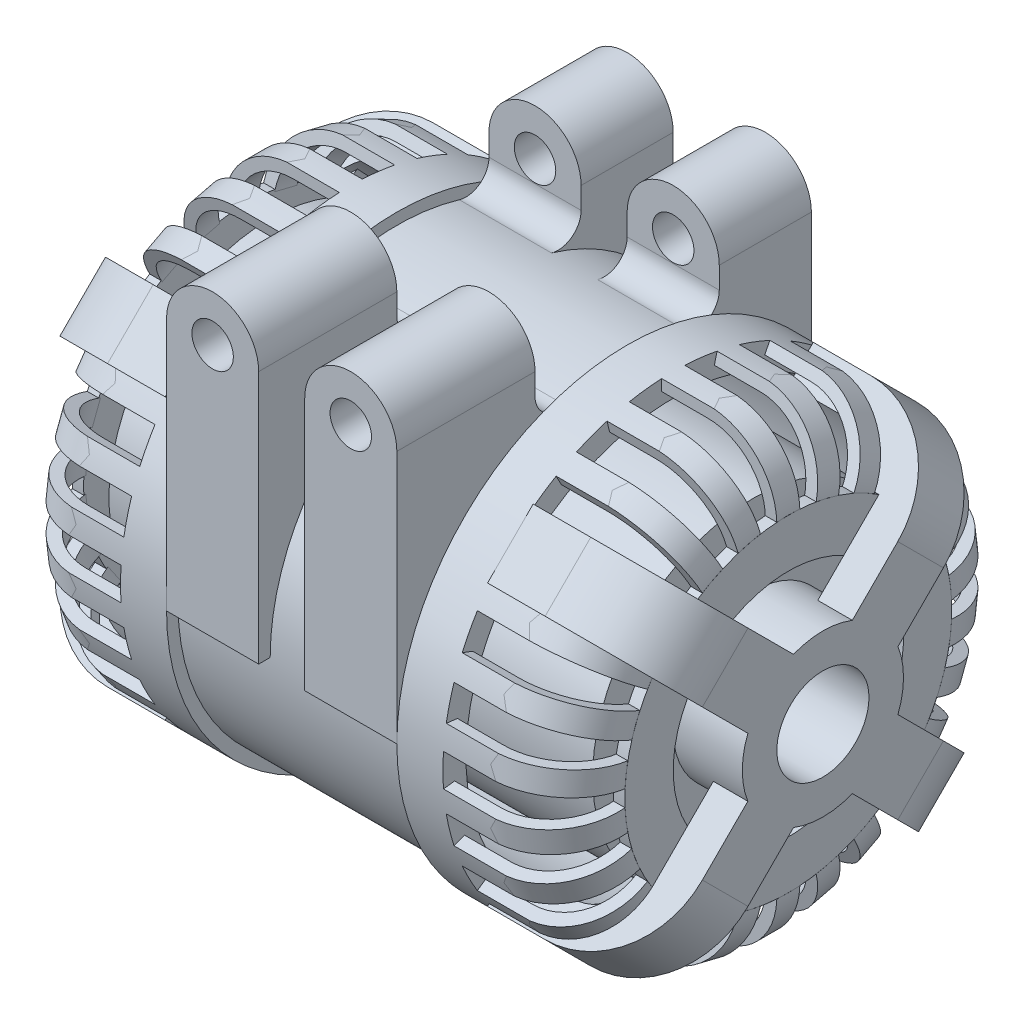
from build123d import *

# Parameters (mm, degrees)
SKETCH1_R                 = 50
SKETCH1_R_2               = 47.5
BOSS_EXTRUDE1_DEPTH       = 10
BOSS_EXTRUDE2_DEPTH       = 2.5
CIRPATTERN1_COUNT         = 26
SKETCH6_R                 = 35.5
SKETCH6_R_2               = 25
BOSS_EXTRUDE3_DEPTH       = 2.5
SKETCH7_OUTSIDE_W         = 131.138
SKETCH7_OUTSIDE_H         = 131.138
SKETCH7_OUTSIDE_R         = 50
CUT_EXTRUDE4_DEPTH        = 76.0000001
BOSS_EXTRUDE4_DEPTH       = 7
CIRPATTERN2_COUNT         = 4
SKETCH9_R                 = 17.5
BOSS_EXTRUDE5_DEPTH       = 15
SKETCH10_R                = 35
BOSS_EXTRUDE6_DEPTH       = 105
BOSS_EXTRUDE7_DEPTH       = 35
BOSS_EXTRUDE7_DEPTH_BACK  = 35
SKETCH11_R                = 47.5
SKETCH11_R_2              = 45
BOSS_EXTRUDE8_REACH       = 163.961
BOSS_EXTRUDE8_END_RADIUS  = 47.5
SKETCH13_W                = 20
SKETCH13_H                = 20
CUT_EXTRUDE5_DEPTH        = 132.267855966
CUT_EXTRUDE5_DEPTH_BACK   = 132.267855966
SKETCH14_R                = 4.5
FILLET1_R                 = 5
BOSS_EXTRUDE10_REACH      = 159.262
BOSS_EXTRUDE10_END_RADIUS = 47.5
SKETCH15_W                = 20
SKETCH15_H                = 41.306779105
BOSS_EXTRUDE11_START      = -10
SKETCH15_3_R              = 4.5
BOSS_EXTRUDE11_DEPTH      = 10
SKETCH18_R                = 10
CUT_EXTRUDE6_DEPTH        = 20


with BuildPart() as part:
    # Sketch1 → Boss-Extrude1 (new body)
    with BuildSketch(Plane(origin=(0, 0, 0), x_dir=(0, 0, -1), z_dir=(1, 0, 0))):
        Circle(SKETCH1_R)
        Circle(SKETCH1_R_2, mode=Mode.SUBTRACT)
    extrude(amount=-BOSS_EXTRUDE1_DEPTH)

    # Sketch5 → Boss-Extrude2 (add, symmetric)
    with BuildSketch(Plane.XY):
        with BuildLine():
            Line((0, 50), (10, 50))
            ThreePointArc((10, 50), (20.606601718, 45.606601718), (25, 35))
            Line((25, 35), (22.5, 35))
            ThreePointArc((22.5, 35), (18.838834765, 43.838834765), (10, 47.5))
            Line((10, 47.5), (0, 47.5))
            Line((0, 47.5), (0, 50))
        make_face()
    boss_extrude2 = extrude(amount=BOSS_EXTRUDE2_DEPTH, both=True)

    # CirPattern1: Boss-Extrude2 ×26 about axis
    cirpattern1_axis = Axis((0, 0, 0), (1, 0, 0))
    for i in range(1, CIRPATTERN1_COUNT):
        add(boss_extrude2.rotate(cirpattern1_axis, i * 360 / CIRPATTERN1_COUNT))

    # Sketch6 → Boss-Extrude3 (add)
    with BuildSketch(Plane.ZY.offset(-25)):
        with Locations(Location((0, 0, 0), (0, 0, 182.884820327))):
            Circle(SKETCH6_R)
        Circle(SKETCH6_R_2, mode=Mode.SUBTRACT)
    extrude(amount=BOSS_EXTRUDE3_DEPTH)

    # Sketch7 outside → Cut-Extrude4 (cut, through all)
    with BuildSketch(Plane(origin=(0, 0, 0), x_dir=(0, 0, -1), z_dir=(1, 0, 0))):
        Rectangle(SKETCH7_OUTSIDE_W, SKETCH7_OUTSIDE_H)
        Circle(SKETCH7_OUTSIDE_R, mode=Mode.SUBTRACT)
    extrude(amount=CUT_EXTRUDE4_DEPTH, mode=Mode.SUBTRACT)

    # Sketch8 → Boss-Extrude4 (add, symmetric)
    with BuildSketch(Plane(origin=(0, 0, 0), x_dir=(1, 0, 0), z_dir=(0, -0.7071067811865488, 0.7071067811865464))):
        with BuildLine():
            Line((0, 42.5), (0, 50))
            Line((0, 50), (12.5, 50))
            ThreePointArc((12.5, 50), (26.642135624, 44.142135624), (32.5, 30))
            Line((32.5, 30), (32.5, -10))
            Line((32.5, -10), (25, -10))
            Line((25, -10), (25, 30))
            ThreePointArc((25, 30), (21.338834765, 38.838834765), (12.5, 42.5))
            Line((12.5, 42.5), (0, 42.5))
        make_face()
    boss_extrude4 = extrude(amount=BOSS_EXTRUDE4_DEPTH, both=True)

    # CirPattern2: Boss-Extrude4 ×4 about axis
    cirpattern2_axis = Axis((0, 0, 0), (1, 0, 0))
    for i in range(1, CIRPATTERN2_COUNT):
        add(boss_extrude4.rotate(cirpattern2_axis, i * 360 / CIRPATTERN2_COUNT))

    # Sketch9 → Boss-Extrude5 (add)
    with BuildSketch(Plane(origin=(32.5, 0, 0), x_dir=(0, 0, -1), z_dir=(1, 0, 0))):
        with Locations(Location((0, 0, 0), (0, 0, 90))):
            Circle(SKETCH9_R)
    extrude(amount=-BOSS_EXTRUDE5_DEPTH)


with BuildPart() as body_2:
    # Mirror2: mirrored copy
    add(part.part.mirror(Plane(origin=(-35, 0, 0), x_dir=(0, 0, 1), z_dir=(1, 0, 0))))


with BuildPart() as part_1:
    add(part.part)

    add(body_2.part)  # Boss-Extrude6 merges body 2
    # Sketch10 → Boss-Extrude6 (add)
    with BuildSketch(Plane.ZY.offset(-17.5)):
        with Locations(Location((0, 0, 0), (0, 0, 270))):
            Circle(SKETCH10_R)
    extrude(amount=BOSS_EXTRUDE6_DEPTH)

    # Sketch11 → Boss-Extrude7 (add, two sides: drawn at the far end of the back side and taken through both)
    with BuildSketch(Plane(origin=(-35, 0, 0), x_dir=(0, 0, -1), z_dir=(1, 0, 0)).offset(-BOSS_EXTRUDE7_DEPTH_BACK)):
        Circle(SKETCH11_R)
        with Locations(Location((0, 0, 0), (0, 0, 323.949018065))):
            Circle(SKETCH11_R_2, mode=Mode.SUBTRACT)
    extrude(amount=BOSS_EXTRUDE7_DEPTH + BOSS_EXTRUDE7_DEPTH_BACK)

    # Boss-Extrude8: up to this cylinder (the profile starts outside it)
    boss_extrude8_end = Plane(origin=(-35, 0, 0), z_dir=(1, 0, 0)) * Cylinder(BOSS_EXTRUDE8_END_RADIUS, 453.922, mode=Mode.PRIVATE)
    # Sketch13 → Boss-Extrude8 (add, up to the surface)
    with BuildSketch(Plane(origin=(0, 65, 0), x_dir=(1, 0, 0), z_dir=(0, 1, 0)), mode=Mode.PRIVATE) as boss_extrude8_sk1:
        with Locations((-50, 30)):
            Rectangle(SKETCH13_W, SKETCH13_H)
    boss_extrude8_tool1 = extrude(boss_extrude8_sk1.sketch, amount=-BOSS_EXTRUDE8_REACH, mode=Mode.PRIVATE) - boss_extrude8_end
    add(boss_extrude8_tool1.solids().sort_by_distance((-50, 65, -30))[0])
    # Sketch13 → Boss-Extrude8 (add, up to the surface)
    with BuildSketch(Plane(origin=(0, 65, 0), x_dir=(1, 0, 0), z_dir=(0, 1, 0)), mode=Mode.PRIVATE) as boss_extrude8_sk2:
        with Locations((-20, 30)):
            Rectangle(SKETCH13_W, SKETCH13_H)
    boss_extrude8_tool2 = extrude(boss_extrude8_sk2.sketch, amount=-BOSS_EXTRUDE8_REACH, mode=Mode.PRIVATE) - boss_extrude8_end
    add(boss_extrude8_tool2.solids().sort_by_distance((-20, 65, -30))[0])
    # Sketch13 → Boss-Extrude8 (add, up to the surface)
    with BuildSketch(Plane(origin=(0, 65, 0), x_dir=(1, 0, 0), z_dir=(0, 1, 0)), mode=Mode.PRIVATE) as boss_extrude8_sk3:
        with Locations((-50, -30)):
            Rectangle(SKETCH13_W, SKETCH13_H)
    boss_extrude8_tool3 = extrude(boss_extrude8_sk3.sketch, amount=-BOSS_EXTRUDE8_REACH, mode=Mode.PRIVATE) - boss_extrude8_end
    add(boss_extrude8_tool3.solids().sort_by_distance((-50, 65, 30))[0])
    # Sketch13 → Boss-Extrude8 (add, up to the surface)
    with BuildSketch(Plane(origin=(0, 65, 0), x_dir=(1, 0, 0), z_dir=(0, 1, 0)), mode=Mode.PRIVATE) as boss_extrude8_sk4:
        with Locations((-20, -30)):
            Rectangle(SKETCH13_W, SKETCH13_H)
    boss_extrude8_tool4 = extrude(boss_extrude8_sk4.sketch, amount=-BOSS_EXTRUDE8_REACH, mode=Mode.PRIVATE) - boss_extrude8_end
    add(boss_extrude8_tool4.solids().sort_by_distance((-20, 65, 30))[0])

    # Sketch14 → Cut-Extrude5 (cut, two sides: drawn at the far end of the back side and taken through both)
    with BuildSketch(Plane.XY.offset(-CUT_EXTRUDE5_DEPTH_BACK)):
        with Locations((-50, 55)):
            Circle(SKETCH14_R)
        with Locations((-20, 55)):
            Circle(SKETCH14_R)
        with BuildLine():
            Line((-40, 55), (-30, 55))
            ThreePointArc((-30, 55), (-20, 65), (-10, 55))
            Line((-10, 55), (0, 55))
            Line((0, 55), (0, 106.437908956))
            Line((0, 106.437908956), (-77.002935494, 106.437908956))
            Line((-77.002935494, 106.437908956), (-77.002935494, 55))
            Line((-77.002935494, 55), (-60, 55))
            ThreePointArc((-60, 55), (-50, 65), (-40, 55))
        make_face()
    extrude(amount=CUT_EXTRUDE5_DEPTH + CUT_EXTRUDE5_DEPTH_BACK, mode=Mode.SUBTRACT)

    # Fillet1
    # the kernel refuses this fillet: 5 mm, written as the material it adds along each edge
    with BuildSketch(Plane(origin=(-63.560644128, 25.617376915, -40), x_dir=(0, -0.8497104628415025, -0.5272495892247615), z_dir=(1, 0, 0)), Plane(origin=(-30, 25.617376915, -40), x_dir=(0, -0.8497104628415049, -0.5272495892247575), z_dir=(1, 0, 0))) as fillet1_piece_1:
        with BuildLine():
            CenterArc((1.426041318, 4.999491576), FILLET1_R, 238.180191681, 31.002719134)
            Line((-1.210206628, 0.750939261), (0, 0))
            ThreePointArc((0, 0), (0.677369626, 0.004830031), (1.354739252, 0))
        make_face()
    extrude(amount=23.560644128)
    with BuildSketch(Plane(origin=(-60, 43.084219849, -20), x_dir=(0, 0.35431235312785675, 0.9351271338278025), z_dir=(1, 0, 0)), Plane(origin=(-30, 43.084219849, -20), x_dir=(0, 0.35431235312785675, 0.9351271338278025), z_dir=(1, 0, 0))) as fillet1_piece_2:
        with BuildLine():
            CenterArc((7.236360756, -4.986891588), FILLET1_R, 94.149756386, 106.601549599)
            Line((2.560725087, -6.758453353), (0, 0))
            ThreePointArc((0, 0), (3.437271359, -0.124529917), (6.874542718, 0))
        make_face()
    extrude(amount=20)
    with BuildSketch(Plane(origin=(-60, 43.084219849, -20), x_dir=(0, 0.35431235312785675, 0.9351271338278025), z_dir=(1, 0, 0))) as fillet1_piece_3_section:
        with BuildLine():
            CenterArc((7.236360756, -4.986891588), FILLET1_R, 94.149756386, 106.601549599)
            Line((2.560725087, -6.758453353), (0, 0))
            ThreePointArc((0, 0), (3.437271359, -0.124529917), (6.874542718, 0))
        make_face()
    fillet1_piece_3 = extrude(amount=38.068274112, mode=Mode.PRIVATE)
    fillet1_piece_3 = split(fillet1_piece_3, bisect_by=Plane(origin=(-30, 45.468013106, -18.483982449), z_dir=(1, 0, 0)), keep=Keep.TOP, mode=Mode.PRIVATE)
    add(fillet1_piece_3)
    with BuildSketch(Plane(origin=(-48.068274112, 43.084219849, -20), x_dir=(0, 0.3543123531278575, 0.9351271338278023), z_dir=(1, 0, 0))) as fillet1_piece_4_section:
        with BuildLine():
            CenterArc((7.236360756, -4.986891588), FILLET1_R, 94.149756386, 106.601549599)
            Line((2.560725087, -6.758453353), (0, 0))
            ThreePointArc((0, 0), (3.437271359, -0.124529917), (6.874542718, 0))
        make_face()
    fillet1_piece_4 = extrude(amount=38.068274112, mode=Mode.PRIVATE)
    fillet1_piece_4 = split(fillet1_piece_4, bisect_by=Plane(origin=(-40, 45.468013106, -18.483982449), z_dir=(-1, 0, 0)), keep=Keep.TOP, mode=Mode.PRIVATE)
    add(fillet1_piece_4)
    with BuildSketch(Plane(origin=(-60, 43.084219849, 20), x_dir=(0, 0.3543123531278576, -0.9351271338278021), z_dir=(1, 0, 0)), Plane(origin=(-30, 43.084219849, 20), x_dir=(0, 0.3543123531278576, -0.9351271338278021), z_dir=(1, 0, 0))) as fillet1_piece_5:
        with BuildLine():
            CenterArc((7.236360756, 4.986891588), FILLET1_R, 159.248694015, 106.601549599)
            Line((2.560725087, 6.758453353), (0, 0))
            ThreePointArc((0, 0), (3.437271359, 0.124529917), (6.874542718, 0))
        make_face()
    extrude(amount=20)
    with BuildSketch(Plane(origin=(-60, 43.084219849, 20), x_dir=(0, 0.3543123531278576, -0.9351271338278021), z_dir=(1, 0, 0))) as fillet1_piece_6_section:
        with BuildLine():
            CenterArc((7.236360756, 4.986891588), FILLET1_R, 159.248694015, 106.601549599)
            Line((2.560725087, 6.758453353), (0, 0))
            ThreePointArc((0, 0), (3.437271359, 0.124529917), (6.874542718, 0))
        make_face()
    fillet1_piece_6 = extrude(amount=38.068274112, mode=Mode.PRIVATE)
    fillet1_piece_6 = split(fillet1_piece_6, bisect_by=Plane(origin=(-30, 45.468013106, 18.483982449), z_dir=(1, 0, 0)), keep=Keep.TOP, mode=Mode.PRIVATE)
    add(fillet1_piece_6)
    with BuildSketch(Plane(origin=(-48.068274112, 43.084219849, 20), x_dir=(0, 0.3543123531278576, -0.9351271338278021), z_dir=(1, 0, 0))) as fillet1_piece_7_section:
        with BuildLine():
            CenterArc((7.236360756, 4.986891588), FILLET1_R, 159.248694015, 106.601549599)
            Line((2.560725087, 6.758453353), (0, 0))
            ThreePointArc((0, 0), (3.437271359, 0.124529917), (6.874542718, 0))
        make_face()
    fillet1_piece_7 = extrude(amount=38.068274112, mode=Mode.PRIVATE)
    fillet1_piece_7 = split(fillet1_piece_7, bisect_by=Plane(origin=(-40, 45.468013106, 18.483982449), z_dir=(-1, 0, 0)), keep=Keep.TOP, mode=Mode.PRIVATE)
    add(fillet1_piece_7)

    # Boss-Extrude10: up to this cylinder (the profile starts outside it)
    boss_extrude10_end = Plane(origin=(-35, 0, 0), z_dir=(1, 0, 0)) * Cylinder(BOSS_EXTRUDE10_END_RADIUS, 444.524, mode=Mode.PRIVATE)
    # Sketch15 → Boss-Extrude10 (add, up to the surface)
    with BuildSketch(Plane.XY.offset(50), mode=Mode.PRIVATE) as boss_extrude10_sk1:
        with Locations((-50, 20.653389553)):
            Rectangle(SKETCH15_W, SKETCH15_H)
    boss_extrude10_tool1 = extrude(boss_extrude10_sk1.sketch, amount=-BOSS_EXTRUDE10_REACH, mode=Mode.PRIVATE) - boss_extrude10_end
    add(boss_extrude10_tool1.solids().sort_by_distance((-50, 20.65339, 50))[0])
    # Sketch15 → Boss-Extrude10 (add, up to the surface)
    with BuildSketch(Plane.XY.offset(50), mode=Mode.PRIVATE) as boss_extrude10_sk2:
        with Locations((-20, 20.653389553)):
            Rectangle(SKETCH15_W, SKETCH15_H)
    boss_extrude10_tool2 = extrude(boss_extrude10_sk2.sketch, amount=-BOSS_EXTRUDE10_REACH, mode=Mode.PRIVATE) - boss_extrude10_end
    add(boss_extrude10_tool2.solids().sort_by_distance((-20, 20.65339, 50))[0])

    # Sketch15<3> → Boss-Extrude11 (add)
    # profile 1 of 2: a face of its own
    with BuildSketch(Plane.XY.offset(50).offset(BOSS_EXTRUDE11_START)):
        with BuildLine():
            ThreePointArc((-40, 55), (-50, 65), (-60, 55))
            Line((-60, 55), (-60, 41.306779105))
            Line((-60, 41.306779105), (-40, 41.306779105))
            Line((-40, 41.306779105), (-40, 55))
        make_face()
        with Locations((-50, 55)):
            Circle(SKETCH15_3_R, mode=Mode.SUBTRACT)
    # profile 2 of 2: a face of its own
    with BuildSketch(Plane.XY.offset(50).offset(BOSS_EXTRUDE11_START)):
        with BuildLine():
            ThreePointArc((-10, 55), (-20, 65), (-30, 55))
            Line((-30, 55), (-30, 41.306779105))
            Line((-30, 41.306779105), (-10, 41.306779105))
            Line((-10, 41.306779105), (-10, 55))
        make_face()
        with Locations((-20, 55)):
            Circle(SKETCH15_3_R, mode=Mode.SUBTRACT)
    extrude(amount=BOSS_EXTRUDE11_DEPTH)

    # Sketch18 → Cut-Extrude6 (cut)
    with BuildSketch(Plane(origin=(32.5, 0, 0), x_dir=(0, 0, -1), z_dir=(1, 0, 0))):
        Circle(SKETCH18_R)
    extrude(amount=-CUT_EXTRUDE6_DEPTH, mode=Mode.SUBTRACT)


solid = part_1.part
